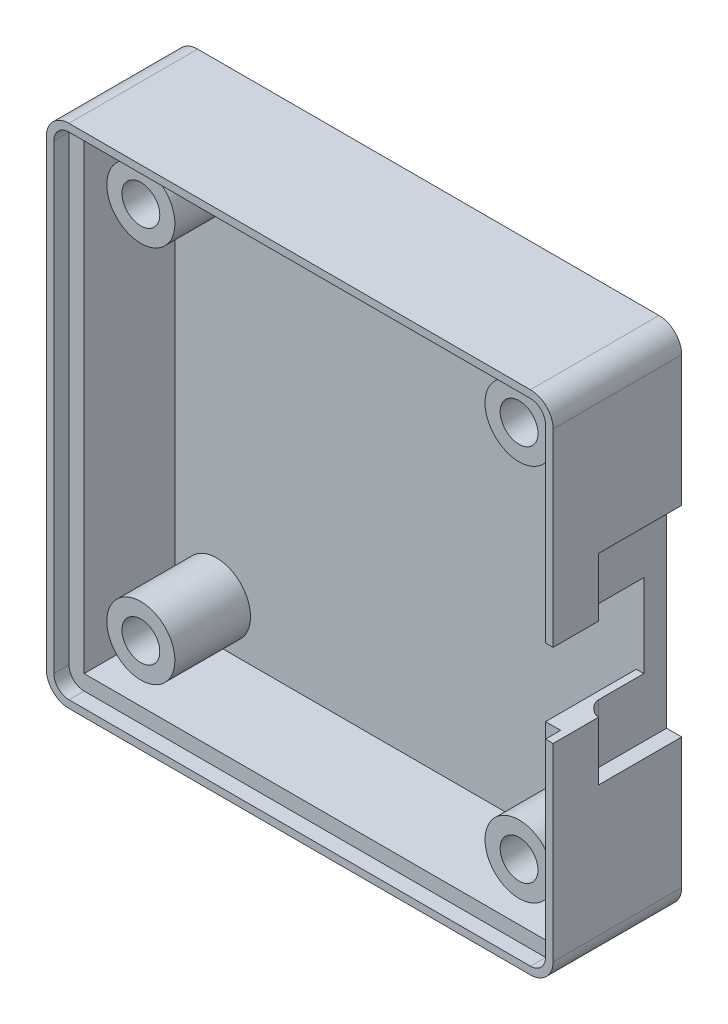
from build123d import *

# Parameters (mm, degrees)
SKETCH1_W           = 67
SKETCH1_H           = 67
BOSS_EXTRUDE1_DEPTH = 17
SKETCH2_W           = 61
SKETCH2_H           = 61
CUT_EXTRUDE1_DEPTH  = 14
CUT_EXTRUDE2_START  = 17
SKETCH3_W           = 65
SKETCH3_H           = 65
CUT_EXTRUDE2_DEPTH  = 2
FILLET1_R           = 3
FILLET3_R           = 2
FILLET4_R           = 2
FILLET5_R           = 2
FILLET6_R           = 2
FILLET7_R           = 3
FILLET8_R           = 3
FILLET9_R           = 3
SKETCH4_R           = 4.5
SKETCH4_R_2         = 2.5
BOSS_EXTRUDE2_DEPTH = 10
SKETCH5_R           = 2.5
BOSS_EXTRUDE3_DEPTH = 5
SKETCH6_W           = 28
SKETCH6_H           = 11
CUT_EXTRUDE3_DEPTH  = 6
SKETCH7_W           = 21.976496756
SKETCH7_H           = 26.513580245
CUT_EXTRUDE4_DEPTH  = 2
FILLET12_SIZE       = 2
FILLET13_SIZE       = 2


with BuildPart() as part:
    # Sketch1 → Boss-Extrude1 (new body)
    with BuildSketch(Plane.XY):
        with Locations((-0.121691543, -4.270311459)):
            Rectangle(SKETCH1_W, SKETCH1_H)
    extrude(amount=BOSS_EXTRUDE1_DEPTH)

    # Sketch2 → Cut-Extrude1 (cut)
    with BuildSketch(Plane.XY.offset(17)):
        with Locations((-0.121691543, -4.270311459)):
            Rectangle(SKETCH2_W, SKETCH2_H)
    extrude(amount=-CUT_EXTRUDE1_DEPTH, mode=Mode.SUBTRACT)

    # Sketch3 → Cut-Extrude2 (cut)
    with BuildSketch(Plane.XY.offset(CUT_EXTRUDE2_START)):
        with Locations((-0.121691543, -4.270311459)):
            Rectangle(SKETCH3_W, SKETCH3_H)
    extrude(amount=-CUT_EXTRUDE2_DEPTH, mode=Mode.SUBTRACT)

    # Fillet1
    fillet1_edges = [part.edges().sort_by_distance(p)[0] for p in [
        (-33.621691543, -37.770311459, 8.5),
    ]]
    fillet(fillet1_edges, radius=FILLET1_R)

    # Fillet3
    fillet3_edges = [part.edges().sort_by_distance(p)[0] for p in [
        (-32.621691543, -36.770311459, 16),
    ]]
    fillet(fillet3_edges, radius=FILLET3_R)

    # Fillet4
    fillet4_edges = [part.edges().sort_by_distance(p)[0] for p in [
        (-32.621691543, 28.229688541, 16),
    ]]
    fillet(fillet4_edges, radius=FILLET4_R)

    # Fillet5
    fillet5_edges = [part.edges().sort_by_distance(p)[0] for p in [
        (32.378308457, 28.229688541, 16),
    ]]
    fillet(fillet5_edges, radius=FILLET5_R)

    # Fillet6
    fillet6_edges = [part.edges().sort_by_distance(p)[0] for p in [
        (32.378308457, -36.770311459, 16),
    ]]
    fillet(fillet6_edges, radius=FILLET6_R)

    # Fillet7
    fillet7_edges = [part.edges().sort_by_distance(p)[0] for p in [
        (33.378308457, -37.770311459, 8.5),
    ]]
    fillet(fillet7_edges, radius=FILLET7_R)

    # Fillet8
    fillet8_edges = [part.edges().sort_by_distance(p)[0] for p in [
        (33.378308457, 29.229688541, 8.5),
    ]]
    fillet(fillet8_edges, radius=FILLET8_R)

    # Fillet9
    fillet9_edges = [part.edges().sort_by_distance(p)[0] for p in [
        (-33.621691543, 29.229688541, 8.5),
    ]]
    fillet(fillet9_edges, radius=FILLET9_R)

    # Sketch4 → Boss-Extrude2 (add)
    # profile 1 of 4: a face of its own
    with BuildSketch(Plane.XY.offset(3)):
        with Locations(Location((24.878308457, -29.270311459, 0), (0, 0, 180))):
            Circle(SKETCH4_R)
        with Locations((24.878308457, -29.270311459)):
            Circle(SKETCH4_R_2, mode=Mode.SUBTRACT)
    # profile 2 of 4: a face of its own
    with BuildSketch(Plane.XY.offset(3)):
        with Locations(Location((-25.121691543, -29.270311459, 0), (0, 0, 180))):
            Circle(SKETCH4_R)
        with Locations((-25.121691543, -29.270311459)):
            Circle(SKETCH4_R_2, mode=Mode.SUBTRACT)
    # profile 3 of 4: a face of its own
    with BuildSketch(Plane.XY.offset(3)):
        with Locations(Location((-25.121691543, 20.729688541, 0), (0, 0, 180))):
            Circle(SKETCH4_R)
        with Locations((-25.121691543, 20.729688541)):
            Circle(SKETCH4_R_2, mode=Mode.SUBTRACT)
    # profile 4 of 4: a face of its own
    with BuildSketch(Plane.XY.offset(3)):
        with Locations(Location((24.878308457, 20.729688541, 0), (0, 0, 180))):
            Circle(SKETCH4_R)
        with Locations((24.878308457, 20.729688541)):
            Circle(SKETCH4_R_2, mode=Mode.SUBTRACT)
    extrude(amount=BOSS_EXTRUDE2_DEPTH)

    # Sketch5 → Boss-Extrude3 (add)
    with BuildSketch(Plane.XY.offset(3)):
        with Locations((24.878308457, -29.270311459)):
            Circle(SKETCH5_R)
        with Locations((-25.121691543, -29.270311459)):
            Circle(SKETCH5_R)
        with Locations((-25.121691543, 20.729688541)):
            Circle(SKETCH5_R)
        with Locations((24.878308457, 20.729688541)):
            Circle(SKETCH5_R)
    extrude(amount=BOSS_EXTRUDE3_DEPTH)

    # Sketch6 → Cut-Extrude3 (cut)
    with BuildSketch(Plane(origin=(33.378308457, 0, 0), x_dir=(0, 0, -1), z_dir=(1, 0, 0))):
        with Locations((-17, -4.270311459)):
            Rectangle(SKETCH6_W, SKETCH6_H)
    extrude(amount=-CUT_EXTRUDE3_DEPTH, mode=Mode.SUBTRACT)

    # Sketch7 → Cut-Extrude4 (cut)
    with BuildSketch(Plane(origin=(33.378308457, 0, 0), x_dir=(0, 0, -1), z_dir=(1, 0, 0))):
        with Locations((0, -4.27031146)):
            Rectangle(SKETCH7_W, SKETCH7_H)
    extrude(amount=-CUT_EXTRUDE4_DEPTH, mode=Mode.SUBTRACT)

    # Fillet12
    # a fillet whose section is not a circle: 2 mm, written as the material it adds along each edge
    with BuildSketch(Plane(origin=(31.378308457, 1.229688541, 10.988248378), x_dir=(0, 0, -1), z_dir=(0, 1, 0))) as fillet12_piece_1:
        with BuildLine():
            Bezier((FILLET12_SIZE, 0), (0, 0), (0, -FILLET12_SIZE), weights=[1, 0.471404521, 1])
            Line((0, -FILLET12_SIZE), (0, 0))
            Line((0, 0), (FILLET12_SIZE, 0))
        make_face()
    extrude(amount=12.756790123)

    # Fillet13
    # a fillet whose section is not a circle: 2 mm, written as the material it adds along each edge
    with BuildSketch(Plane(origin=(31.378308457, -22.527101582, 10.988248378), x_dir=(0, 0, -1), z_dir=(0, 1, 0))) as fillet13_piece_1:
        with BuildLine():
            Bezier((FILLET13_SIZE, 0), (0, 0), (0, -FILLET13_SIZE), weights=[1, 0.471404521, 1])
            Line((0, -FILLET13_SIZE), (0, 0))
            Line((0, 0), (FILLET13_SIZE, 0))
        make_face()
    extrude(amount=12.756790123)


solid = part.part
